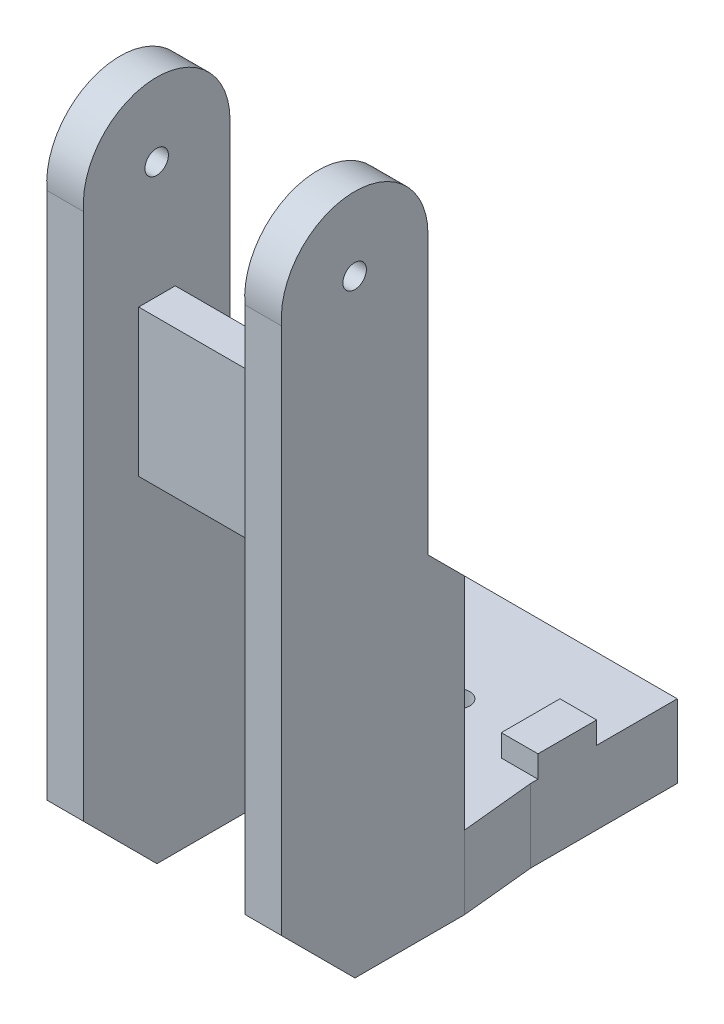
from build123d import *

# Parameters (mm, degrees)
EXTRUDE_1_DEPTH     = 10
SKETCH_4_W          = 5
SKETCH_4_H          = 8
EXTRUDE_3_DEPTH     = 3
EXTRUDE_4_DEPTH     = 16
CUT_EXTRUDE_1_DEPTH = 11
SKETCH_15_W         = 5
SKETCH_15_H         = 20
EXTRUDE_5_DEPTH     = 22
OTHER_START         = -1
OTHER_4_OUTLINE_R   = 1.6
OTHER_4_DEPTH       = 32


# Read off the part's stored shape, not the designer's step: 高级异型孔3, 高级异型孔4
with BuildPart() as part:
    # 草图1 → 凸台-拉伸1 (new body)
    with BuildSketch(Plane(origin=(0, 0, 0), x_dir=(1, 0, 0), z_dir=(0, 1, 0))):
        Polygon((0, 10), (0, 30), (30, 30), (30, 10), (31, 0), (30, 0), (0, 0), (-1, 0), align=None)
    extrude(amount=-EXTRUDE_1_DEPTH)

    # 草图4 → 凸台-拉伸3 (add)
    with BuildSketch(Plane(origin=(0, 0, 0), x_dir=(1, 0, 0), z_dir=(0, 1, 0))):
        with Locations((2.5, 15)):
            Rectangle(SKETCH_4_W, SKETCH_4_H)
        with Locations((27.5, 15)):
            Rectangle(SKETCH_4_W, SKETCH_4_H)
    extrude(amount=EXTRUDE_3_DEPTH)

    # 高级异型孔3 outline → 高级异型孔3 (revolve, cut)
    with BuildSketch(Plane(origin=(15, 0, -15), x_dir=(1, 0, 0), z_dir=(0, 0, 1))):
        Polygon((0, -10), (3.15, -10), (1.7, -8.55), (1.7, 0), (0, 0), align=None)
    revolve(axis=Axis((15, 0, -15), (0, 1, 0)), mode=Mode.SUBTRACT)

    # 草图13 → 凸台-拉伸4 (add, symmetric)
    with BuildSketch(Plane(origin=(15, 0, 0), x_dir=(0, 0, -1), z_dir=(1, 0, 0))):
        with BuildLine():
            Line((-24.95762742, 72), (-24.95762742, 0))
            Line((-24.95762742, 0), (-14.95762742, -10))
            Line((-14.95762742, -10), (0, -10))
            Line((0, -10), (0, 30))
            Line((0, 30), (-5, 35))
            Line((-5, 35), (-5, 72.919595656))
            ThreePointArc((-5, 72.919595656), (-15.460285674, 82.908996895), (-24.95762742, 72))
        make_face()
    extrude(amount=EXTRUDE_4_DEPTH, both=True)

    # 草图13<2> → 切除-拉伸1 (cut, symmetric)
    with BuildSketch(Plane(origin=(15, 0, 0), x_dir=(0, 0, -1), z_dir=(1, 0, 0))):
        with BuildLine():
            Line((-24.95762742, 72), (-24.95762742, 0))
            Line((-24.95762742, 0), (-14.95762742, -10))
            Line((-14.95762742, -10), (0, -10))
            Line((0, -10), (0, 30))
            Line((0, 30), (-5, 35))
            Line((-5, 35), (-5, 72.919595656))
            ThreePointArc((-5, 72.919595656), (-15.460285674, 82.908996895), (-24.95762742, 72))
        make_face()
    extrude(amount=CUT_EXTRUDE_1_DEPTH, both=True, mode=Mode.SUBTRACT)

    # 草图15 → 凸台-拉伸5 (add)
    with BuildSketch(Plane(origin=(4, 0, 0), x_dir=(0, 0, -1), z_dir=(1, 0, 0))):
        with Locations((-14.95762742, 47)):
            Rectangle(SKETCH_15_W, SKETCH_15_H)
    extrude(amount=EXTRUDE_5_DEPTH)

    # 高级异型孔4 outline → 高级异型孔4 (cut)
    with BuildSketch(Plane.YZ.offset(OTHER_START)):
        with Locations((72.919595656, 15)):
            Circle(OTHER_4_OUTLINE_R)
    extrude(amount=OTHER_4_DEPTH, mode=Mode.SUBTRACT)


solid = part.part
